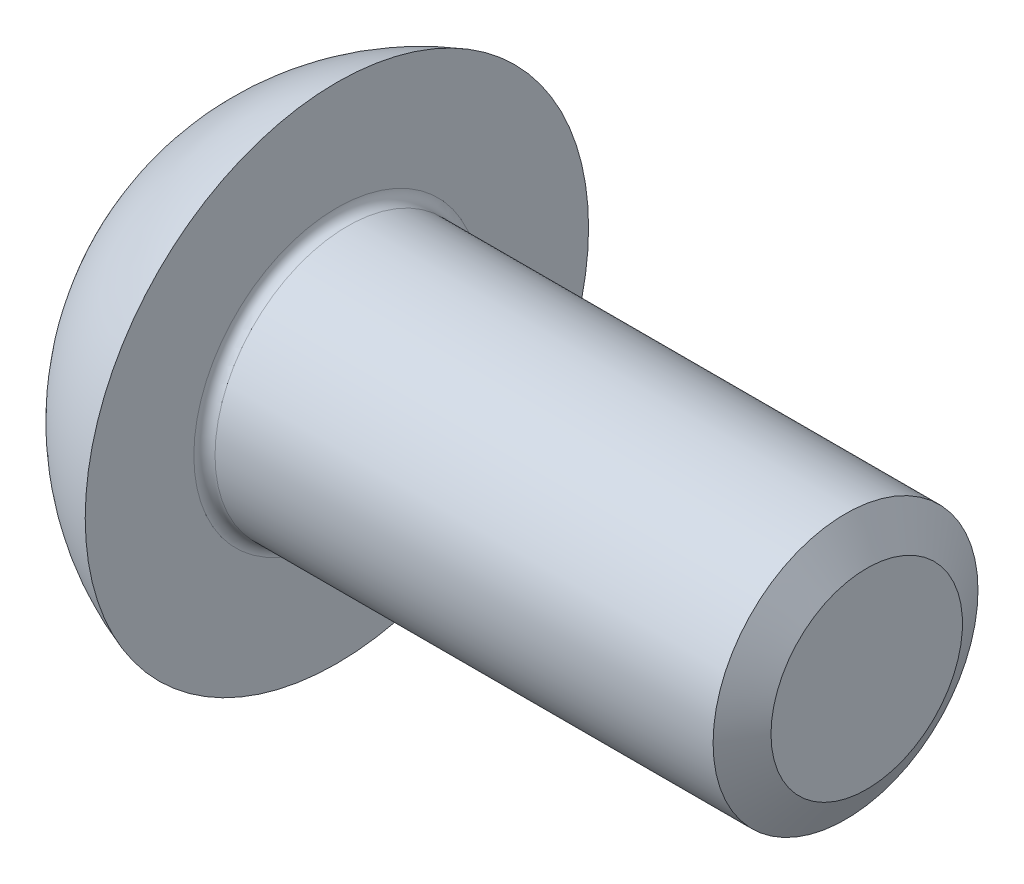
from build123d import *

# Parameters (mm, degrees)
CUT_EXTRUDE_1_DEPTH = 2.75


with BuildPart() as part:
    # 草图1 → 旋转1 (revolve)
    with BuildSketch(Plane.XY):
        with BuildLine():
            Line((0, 2.5), (-9.8, 2.5))
            ThreePointArc((-9.8, 2.5), (-9.941421356, 2.558578644), (-10, 2.7))
            Line((-10, 2.7), (-10, 4.75))
            ThreePointArc((-10, 4.75), (-11.581194586, 3.877015605), (-12.75, 2.5))
            Line((-12.75, 2.5), (-12.75, 0))
            Line((-12.75, 0), (0, 0))
            Line((0, 0), (0, 2.5))
        make_face()
    revolve(axis=Axis((-12.75, 0, 0), (1, 0, 0)))

    # 草图2 → 切除-拉伸1 (cut)
    with BuildSketch(Plane.ZY.offset(12.75)):
        Polygon((0, 1.732050808), (-1.5, 0.866025404), (-1.5, -0.866025404), (0, -1.732050808), (1.5, -0.866025404), (1.5, 0.866025404), align=None)
    extrude(amount=-CUT_EXTRUDE_1_DEPTH, mode=Mode.SUBTRACT)

    # 草图6 → 旋转2 (revolve)
    with BuildSketch(Plane.XY):
        Polygon((-11.19, 1.732050808), (-10, 0), (-9.56, 0), (-9.56, 1.732050808), align=None)
    revolve(axis=Axis((-12.75, 0, 0), (1, 0, 0)))

    # 草图7 → 切除-旋转5 (revolve, cut)
    with BuildSketch(Plane.XY):
        Polygon((-12.75, 1.732050808), (-12.31, 0), (-12.75, 0), align=None)
    revolve(axis=Axis((-12.75, 0, 0), (1, 0, 0)), mode=Mode.SUBTRACT)

    # 草图4 → 切除-旋转1 (revolve, cut)
    with BuildSketch(Plane.XY):
        Polygon((-0.4, 2.5), (0, 1.807179677), (0.4, 2.5), align=None)
    revolve(axis=Axis((-0.4, 0, 0), (1, 0, 0)), mode=Mode.SUBTRACT)


solid = part.part
